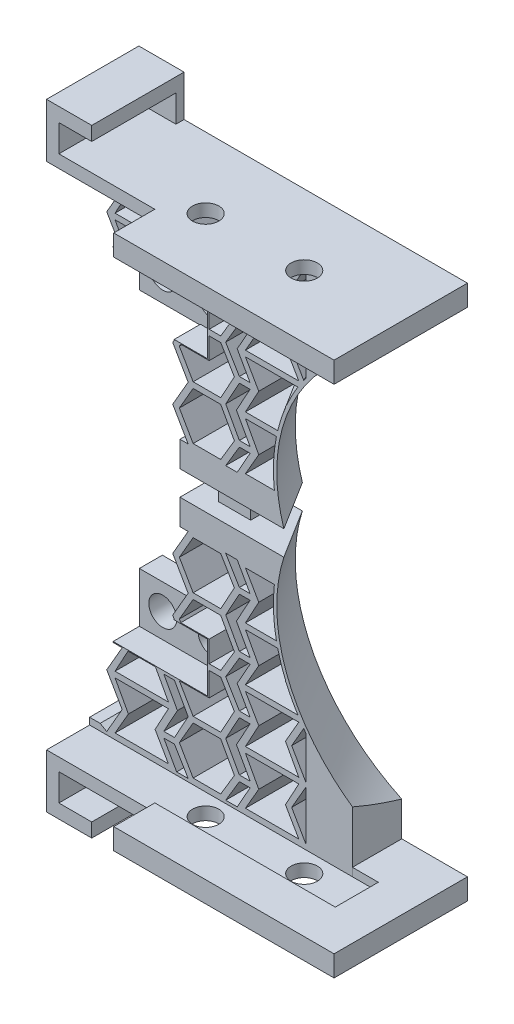
from build123d import *

# Parameters (mm, degrees)
SKETCH2_W                = 32.001289556
SKETCH2_H                = 30.15
BOSS_EXTRUDE1_DEPTH      = 6
SKETCH1_R                = 1.7
CUT_EXTRUDE1_DEPTH       = 6
SKETCH4_W                = 3.2
SKETCH4_H                = 6
CUT_EXTRUDE2_DEPTH       = 11.5
SKETCH6_W                = 7.433917211
SKETCH6_H                = 3.2
CUT_EXTRUDE3_DEPTH       = 6.1
SKETCH7_W                = 40
SKETCH7_H                = 16.24
BOSS_EXTRUDE2_DEPTH      = 7.55
SKETCH8_W                = 35.15
SKETCH8_H                = 5.24
CUT_EXTRUDE4_DEPTH       = 1
SKETCH9_W                = 5
SKETCH9_H                = 7.55
CUT_EXTRUDE5_DEPTH       = 13.18
SKETCH10_W               = 34.5
SKETCH10_H               = 5
CUT_EXTRUDE6_DEPTH       = 17
SKETCH11_W               = 10.25
SKETCH11_H               = 3.3
CUT_EXTRUDE7_DEPTH       = 4
SKETCH12_R               = 1.6
CUT_EXTRUDE8_DEPTH       = 4
SKETCH13_W               = 32
SKETCH13_H               = 6
CUT_EXTRUDE9_DEPTH       = 1.63
BOSS_EXTRUDE5_DEPTH      = 16.5
BOSS_EXTRUDE5_DEPTH_BACK = 2
SKETCH23_R               = 21.85
CUT_EXTRUDE15_DEPTH      = 16.5
CUT_EXTRUDE15_DEPTH_BACK = 2
SKETCH26_R               = 21.5
SKETCH30_W               = 17.913509877
SKETCH30_H               = 18.5
CUT_EXTRUDE17_DEPTH      = 68
SKETCH33_W               = 15
SKETCH33_H               = 9.450465594
SKETCH33_H_2             = 4.175681338
CUT_EXTRUDE18_DEPTH      = 68
CUT_EXTRUDE19_START      = 36.07
SKETCH34_W               = 21.432896874
SKETCH34_H               = 10.24
SKETCH34_W_2             = 11.620292563
SKETCH34_H_2             = 6
CUT_EXTRUDE19_DEPTH      = 28
SKETCH35_W               = 3.921964069
SKETCH35_H               = 2.491094723
BOSS_EXTRUDE6_DEPTH      = 1.5


with BuildPart() as part:
    # Sketch2 → Boss-Extrude1 (new body)
    with BuildSketch(Plane.XY):
        with Locations((3.6752308, -2.336191967)):
            Rectangle(SKETCH2_W, SKETCH2_H)
    extrude(amount=BOSS_EXTRUDE1_DEPTH)

    # Sketch1 → Cut-Extrude1 (cut)
    with BuildSketch(Plane.XY):
        Polygon((13.145000471, 2.766296997), (11.520000471, -0.231631478), (13.145000471, -3.04621404), (6.645000471, -3.04621404), (8.270000471, -0.231631478), (6.645000471, 2.766296997), align=None)
        Polygon((6.645000471, 3.466296997), (13.145000471, 3.466296997), (11.520000471, 6.464225471), (13.145000471, 9.278808033), (6.645000471, 9.278808033), (8.270000471, 6.464225471), align=None)
        Polygon((0.280803805, 3.466296997), (3.638283686, 3.466296997), (5.303653213, 6.487922091), (3.638283686, 9.278808033), (0.280803805, 9.278808033), (-1.397123601, 6.372552515), align=None)
        Polygon((5.909955549, 6.137922091), (7.216054275, 6.137922091), (5.550684748, 3.116296997), (7.216054275, 0.094671902), (5.909955549, 0.094671902), (4.244586022, 3.116296997), align=None)
        Polygon((5.644586022, -3.39621404), (7.216054275, -6.187099981), (5.909955549, -6.187099981), (4.244586022, -3.39621404), (5.909955549, -0.605328098), (7.216054275, -0.605328098), align=None)
        Polygon((8.270000471, -6.560796602), (6.645000471, -9.558725076), (13.145000471, -9.558725076), (11.520000471, -6.560796602), (13.145000471, -3.74621404), (6.645000471, -3.74621404), align=None)
        Polygon((-1.397123601, -0.139958522), (-1.22320639, -0.441191967), (2.234586022, -0.441191967), (2.234586022, -3.04621404), (3.638283686, -3.04621404), (5.303653213, -0.255328098), (3.638283686, 2.766296997), (0.280803805, 2.766296997), align=None)
        Polygon((3.638283686, -3.74621404), (2.234586022, -3.74621404), (2.234586022, -6.641191967), (-1.390612481, -6.641191967), (-1.397123601, -6.652469558), (0.280803805, -9.558725076), (1.959543746, -9.558725076), (3.638283686, -9.558725076), (5.303653213, -6.537099981), align=None)
        Polygon((-1.397123601, -13.164980595), (0.280803805, -10.258725076), (3.638283686, -10.258725076), (5.303653213, -13.280350171), (3.638283686, -16.071236113), (0.280803805, -16.071236113), align=None)
        Polygon((8.270000471, -13.256653551), (6.645000471, -10.258725076), (13.145000471, -10.258725076), (11.520000471, -13.256653551), (13.145000471, -16.071236113), (6.645000471, -16.071236113), align=None)
        Polygon((-2.72591298, -16.071236113), (-9.22591298, -16.071236113), (-7.60091298, -13.256653551), (-9.22591298, -10.258725076), (-2.72591298, -10.258725076), (-4.35091298, -13.256653551), align=None)
        Polygon((-4.3073354, -6.641191967), (-7.64449056, -6.641191967), (-9.22591298, -9.558725076), (-2.72591298, -9.558725076), align=None)
        Polygon((-1.990868058, -12.930350171), (-0.327277217, -9.905497852), (-1.990868058, -6.887099981), (-3.296966783, -6.887099981), (-1.631597257, -9.908725076), (-3.296966783, -12.930350171), align=None)
        with Locations((-0.615413978, -3.541191967)):
            Circle(SKETCH1_R)
        with Locations((-6.615413978, -3.541191967)):
            Circle(SKETCH1_R)
        Polygon((19.675875578, 12.738808033), (15.92015249, 12.738808033), (15.92015249, -3.646476982), (19.674586022, -3.646476982), (19.675875578, -3.646476982), align=None)
        Polygon((-1.325413978, 9.628808033), (-1.325413978, 12.738808033), (-12.325413978, 12.738808033), (-12.325413978, -15.958137042), (-11.038387071, -15.958137042), (-10.236275951, -16.421236113), (-8.356275951, -13.164980595), (-10.236275951, -9.908725076), (-8.356275951, -6.652469558), (-9.465413978, -6.641191967), (-9.465413978, -3.541191953), (-9.465413978, -0.441191967), (-2.031496767, -0.441191967), (-2.205413978, -0.139958522), (-0.325413978, 3.116296997), (-2.205413978, 6.372552515), (-0.325413978, 9.628808033), align=None)
        Polygon((7.216054275, -6.887099981), (5.909955549, -6.887099981), (4.244586022, -9.908725076), (5.909955549, -12.930350171), (7.216054275, -12.930350171), (5.550684748, -9.908725076), align=None)
        Polygon((5.644586022, -16.421236113), (7.216054275, -13.630350171), (5.909955549, -13.630350171), (4.244586022, -16.421236113), align=None)
        Polygon((14.010874065, -3.145951098), (14.010874065, 2.866034055), (12.275363442, -0.139958522), align=None)
        Polygon((12.275363442, 6.372552515), (14.010874065, 3.366559938), (14.010874065, 9.378545091), align=None)
        Polygon((14.010874065, -9.658462135), (14.010874065, -3.646476982), (12.275363442, -6.652469558), align=None)
        Polygon((14.010874065, -16.170973171), (14.010874065, -10.158988018), (12.275363442, -13.164980595), align=None)
        Polygon((5.644586022, 9.628808033), (7.216054275, 6.837922091), (5.909955549, 6.837922091), (4.244586022, 9.628808033), align=None)
        Polygon((-0.325498531, -16.421236113), (-1.990868058, -13.630350171), (-3.296966783, -13.630350171), (-1.725498531, -16.421236113), align=None)
    extrude(amount=CUT_EXTRUDE1_DEPTH, mode=Mode.SUBTRACT)

    # Sketch4 → Cut-Extrude2 (cut)
    with BuildSketch(Plane.ZY.offset(9.465413978)):
        with Locations((4.4, -3.541191967)):
            Rectangle(SKETCH4_W, SKETCH4_H)
    extrude(amount=-CUT_EXTRUDE2_DEPTH, mode=Mode.SUBTRACT)

    # Sketch6 → Cut-Extrude3 (cut)
    with BuildSketch(Plane(origin=(0, -0.441191967, 0), x_dir=(1, 0, 0), z_dir=(0, 1, 0))):
        with Locations((-5.748455373, -4.4)):
            Rectangle(SKETCH6_W, SKETCH6_H)
    extrude(amount=-CUT_EXTRUDE3_DEPTH, mode=Mode.SUBTRACT)


with BuildPart() as body_2:
    # Sketch7 → Boss-Extrude2 (new body)
    with BuildSketch(Plane(origin=(0, 0, 0), x_dir=(1, 0, 0), z_dir=(0, 1, 0))):
        with Locations((6.194471801, 15.874218806)):
            Rectangle(SKETCH7_W, SKETCH7_H)
    extrude(amount=BOSS_EXTRUDE2_DEPTH)

    # Sketch8 → Cut-Extrude4 (cut)
    with BuildSketch(Plane(origin=(0, 7.55, 0), x_dir=(1, 0, 0), z_dir=(0, 1, 0))):
        with Locations((3.769471801, 15.374218806)):
            Rectangle(SKETCH8_W, SKETCH8_H)
    extrude(amount=-CUT_EXTRUDE4_DEPTH, mode=Mode.SUBTRACT)

    # Sketch9 → Cut-Extrude5 (cut)
    with BuildSketch(Plane.ZY.offset(13.805528199)):
        with Locations((-10.254218806, 3.775)):
            Rectangle(SKETCH9_W, SKETCH9_H)
    extrude(amount=-CUT_EXTRUDE5_DEPTH, mode=Mode.SUBTRACT)

    # Sketch10 → Cut-Extrude6 (cut)
    with BuildSketch(Plane(origin=(0, 0, -23.994218806), x_dir=(-1, 0, 0), z_dir=(0, 0, -1))):
        with Locations((-8.944471801, 2.5)):
            Rectangle(SKETCH10_W, SKETCH10_H)
    extrude(amount=-CUT_EXTRUDE6_DEPTH, mode=Mode.SUBTRACT)

    # Sketch11 → Cut-Extrude7 (cut)
    with BuildSketch(Plane(origin=(-8.305528199, 0, 0), x_dir=(0, 0, -1), z_dir=(1, 0, 0))):
        with Locations((17.879218806, 3.35)):
            Rectangle(SKETCH11_W, SKETCH11_H)
    extrude(amount=-CUT_EXTRUDE7_DEPTH, mode=Mode.SUBTRACT)

    # Sketch12 → Cut-Extrude8 (cut)
    with BuildSketch(Plane(origin=(0, 6.55, 0), x_dir=(1, 0, 0), z_dir=(0, 1, 0))):
        with Locations(Location((2.924471801, 15.394218806, 0), (0, 0, 270))):
            Circle(SKETCH12_R)
        with Locations(Location((14.924471801, 15.394218806, 0), (0, 0, 270))):
            Circle(SKETCH12_R)
    extrude(amount=-CUT_EXTRUDE8_DEPTH, mode=Mode.SUBTRACT)

    # Sketch13 → Cut-Extrude9 (cut)
    with BuildSketch(Plane(origin=(0, 7.55, 0), x_dir=(1, 0, 0), z_dir=(0, 1, 0))):
        with Locations((2.194471801, 20.994218806)):
            Rectangle(SKETCH13_W, SKETCH13_H)
    extrude(amount=-CUT_EXTRUDE9_DEPTH, mode=Mode.SUBTRACT)


with BuildPart() as part_1:
    # Body-Move/Copy1: read off the stored shape, not the designer's step
    # Body-Move/Copy1: moved
    add(part.part.moved(Location((-1.4814038, 23.331192, -23.9942188))))

    # Sketch23 → Boss-Extrude5 (add, two sides: drawn at the far end of the back side and taken through both)
    with BuildSketch(Plane(origin=(-9.074952039, 0, -14.522959097), x_dir=(0, -1, 0), z_dir=(0.5299192642332092, 0, 0.8480480961564233)).offset(-BOSS_EXTRUDE5_DEPTH_BACK)):
        with Locations(Location((-30.5, 38.650954339, 0), (0, 0, 90))):
            Circle(SKETCH23_R)
    extrude(amount=BOSS_EXTRUDE5_DEPTH + BOSS_EXTRUDE5_DEPTH_BACK)

    # Sketch26 → Cut-Extrude15 (cut, two sides: drawn at the far end of the back side and taken through both)
    with BuildSketch(Plane(origin=(-9.074952039, 0, -14.522959097), x_dir=(0, -1, 0), z_dir=(0.5299192642332092, 0, 0.8480480961564233)).offset(-CUT_EXTRUDE15_DEPTH_BACK)):
        with Locations(Location((-30.5, 38.650954339, 0), (0, 0, 90))):
            Circle(SKETCH26_R)
    extrude(amount=CUT_EXTRUDE15_DEPTH + CUT_EXTRUDE15_DEPTH_BACK, mode=Mode.SUBTRACT)

    # Sketch30 → Cut-Extrude17 (cut)
    with BuildSketch(Plane(origin=(-2.830576161, 0, 1.768740291), x_dir=(0, -1, 0), z_dir=(-0.8480480961564233, 0, 0.5299192642332092))):
        with Locations((-45.026754939, -9.87515972)):
            Rectangle(SKETCH30_W, SKETCH30_H)
    extrude(amount=-CUT_EXTRUDE17_DEPTH, mode=Mode.SUBTRACT)

    # Sketch33 → Cut-Extrude18 (cut)
    with BuildSketch(Plane.XZ.offset(-5)):
        Polygon((26.194471801, -23.994218806), (3.025304733, -23.994218806), (3.025304733, -48.994218806), (50.976434964, -48.994218806), (50.976434964, -23.994218806), (41.194471801, -23.994218806), (41.194471801, -28.169900144), (26.194471801, -28.169900144), align=None)
        with Locations((33.694471801, -19.268986009)):
            Rectangle(SKETCH33_W, SKETCH33_H)
        with Locations((33.694471801, -26.082059475)):
            Rectangle(SKETCH33_W, SKETCH33_H_2)
    extrude(amount=-CUT_EXTRUDE18_DEPTH, mode=Mode.SUBTRACT)

    # Sketch34 → Cut-Extrude19 (cut)
    with BuildSketch(Plane(origin=(0, 0, 0), x_dir=(1, 0, 0), z_dir=(0, 1, 0)).offset(CUT_EXTRUDE19_START)):
        with Locations((17.323841817, 12.874218806)):
            Rectangle(SKETCH34_W, SKETCH34_H)
        with Locations((24.004618083, 20.994218806)):
            Rectangle(SKETCH34_W_2, SKETCH34_H_2)
    extrude(amount=-CUT_EXTRUDE19_DEPTH, mode=Mode.SUBTRACT)

    # Sketch35 → Boss-Extrude6 (add)
    with BuildSketch(Plane(origin=(0, 36.07, 0), x_dir=(1, 0, 0), z_dir=(0, 1, 0))):
        with Locations((1.960982035, 21.121044967)):
            Rectangle(SKETCH35_W, SKETCH35_H)
    extrude(amount=BOSS_EXTRUDE6_DEPTH)


with BuildPart() as body_3:
    # Mirror5: mirrored copy
    add(part_1.part.mirror(Plane.ZX.offset(37.57)))


with BuildPart() as body_4:
    # Mirror5 2: mirrored copy
    add(body_2.part.mirror(Plane.ZX.offset(37.57)))


solid = Compound([body_2.part, part_1.part, body_3.part, body_4.part])
